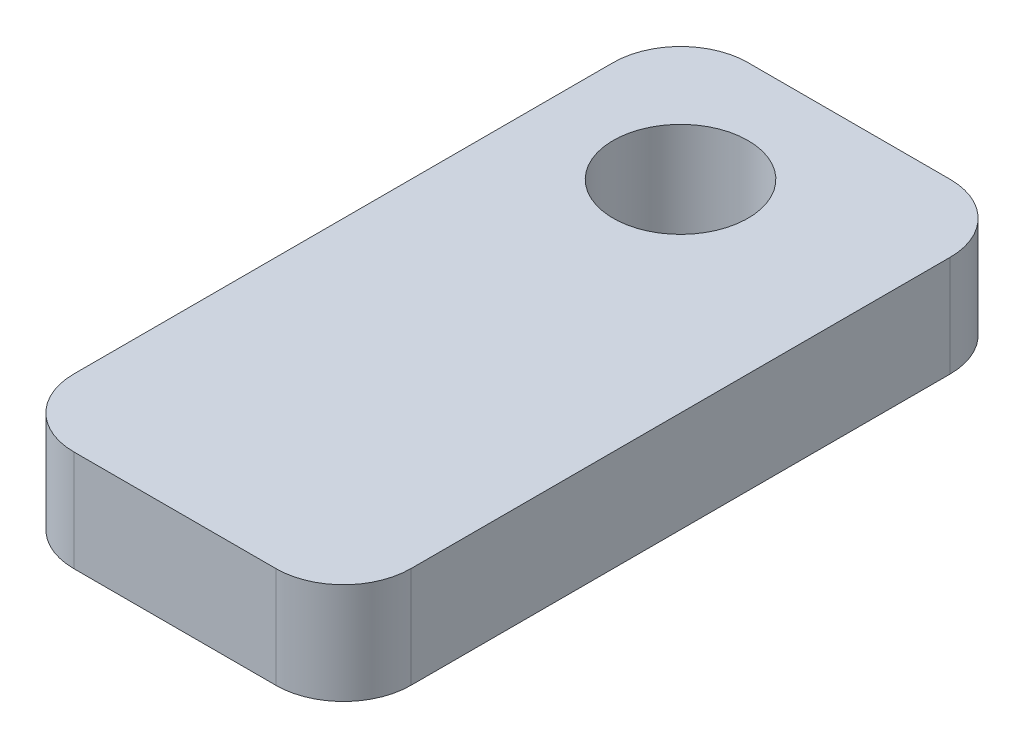
from build123d import *

# Parameters (mm, degrees)
SKETCH1_W           = 6.35
SKETCH1_H           = 12.7
SKETCH1_R           = 1.27
BOSS_EXTRUDE1_DEPTH = 1.905
FILLET1_R           = 1.27


with BuildPart() as part:
    # Sketch1 → Boss-Extrude1 (new body)
    with BuildSketch(Plane(origin=(0, 0, 0), x_dir=(1, 0, 0), z_dir=(0, 1, 0))):
        with Locations((0.635, -3.81)):
            Rectangle(SKETCH1_W, SKETCH1_H)
        Circle(SKETCH1_R, mode=Mode.SUBTRACT)
    extrude(amount=BOSS_EXTRUDE1_DEPTH)

    # Fillet1
    fillet1_edges = [part.edges().sort_by_distance(p)[0] for p in [
        (-2.54, 0.9525, -2.54),
        (3.81, 0.9525, -2.54),
        (3.81, 0.9525, 10.16),
        (-2.54, 0.9525, 10.16),
    ]]
    fillet(fillet1_edges, radius=FILLET1_R)


solid = part.part
